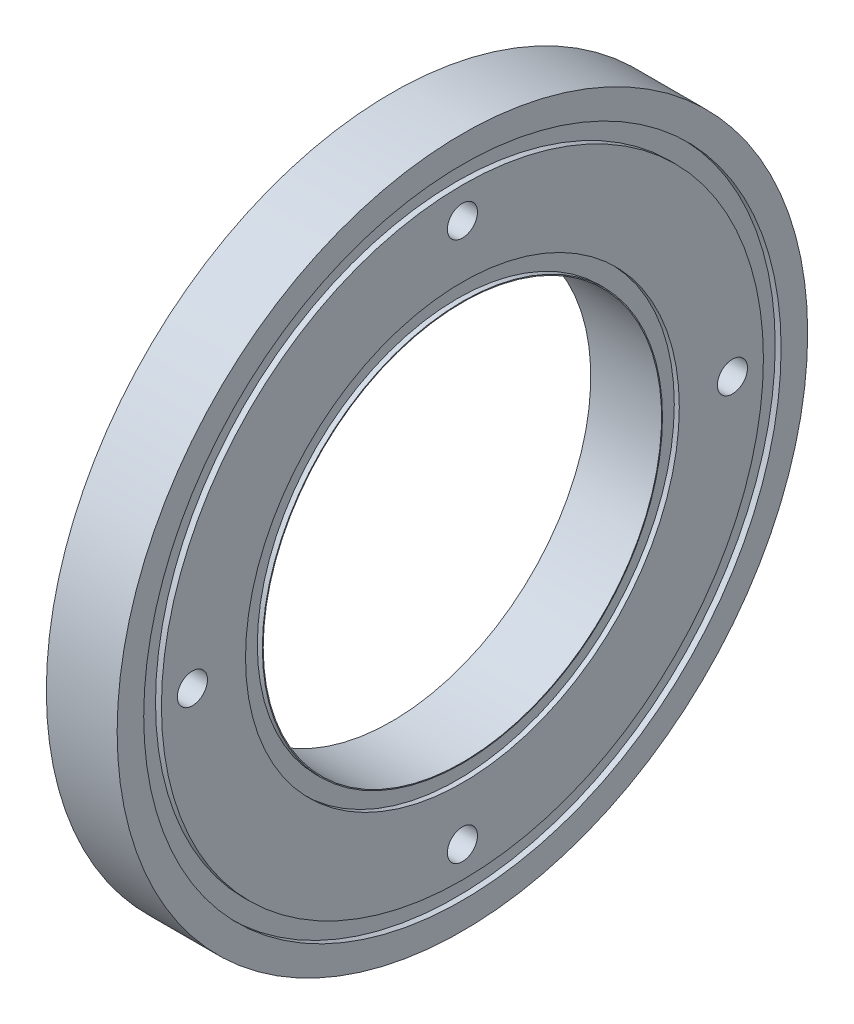
from build123d import *

# Parameters (mm, degrees)
M3_CLEARANCE_HOLE1_D     = 3.4
M3_CLEARANCE_HOLE1_DEPTH = 8
M3_CLEARANCE_HOLE1_TIP   = 1.021463052


with BuildPart() as part:
    # Sketch1 → Revolve17 (revolve)
    with BuildSketch(Plane.XY):
        Polygon((20.481671209, 24.5), (21.047671209, 24.5), (21.047671209, 34), (20.380671209, 34), (20.380671209, 36), (21.047671209, 36), (21.047671209, 39), (13.047671209, 39), (13.047671209, 36), (13.714671209, 36), (13.714671209, 34), (13.047671209, 34), (13.047671209, 24.5), (13.613671209, 24.5), (13.613671209, 22.6), (13.047671209, 22.6), (13.047671209, 22.5), (21.047671209, 22.5), (21.047671209, 22.6), (20.481671209, 22.6), align=None)
    revolve(axis=Axis((-801.920554309, 0, 0), (1, 0, 0)))

    # M3 Clearance Hole1
    with Locations(Plane.ZY.offset(-13.047671209)):
        with Locations((0, -30.5), (0, 30.5), (30.5, 0), (-30.5, 0)):
            Hole(M3_CLEARANCE_HOLE1_D / 2, depth=M3_CLEARANCE_HOLE1_DEPTH)
            with Locations((0, 0, -(M3_CLEARANCE_HOLE1_DEPTH + M3_CLEARANCE_HOLE1_TIP / 2))):  # 118° drill point
                Cone(0, M3_CLEARANCE_HOLE1_D / 2, M3_CLEARANCE_HOLE1_TIP, mode=Mode.SUBTRACT)


solid = part.part
